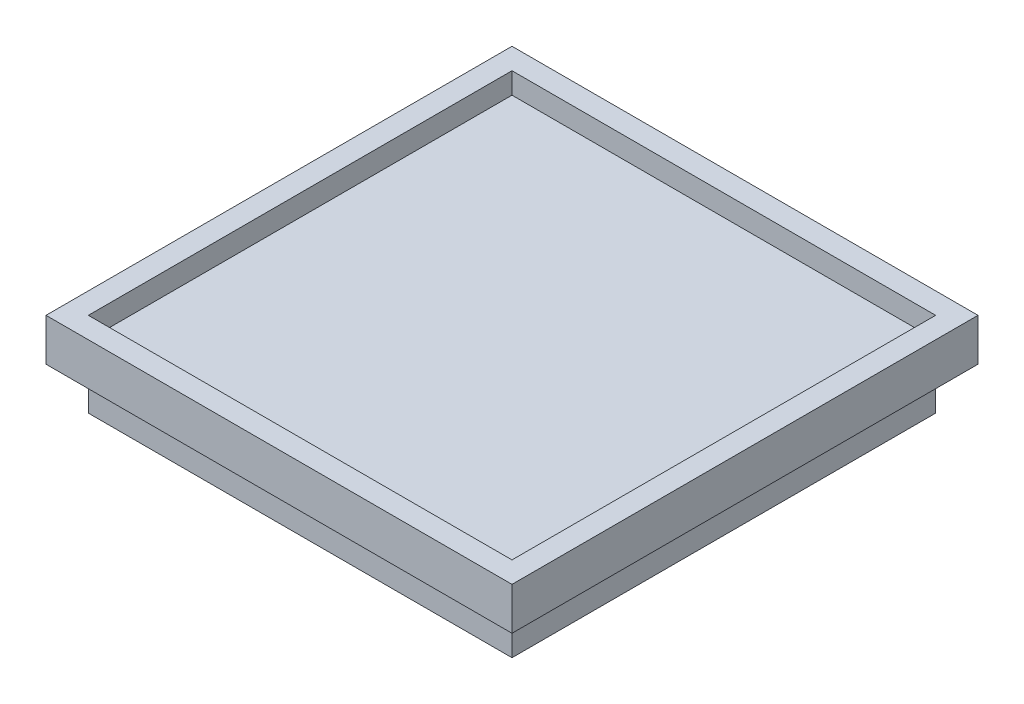
from build123d import *

# Parameters (mm, degrees)
SKETCH1_W           = 139.7
SKETCH1_H           = 139.7
BOSS_EXTRUDE1_DEPTH = 6.35
SKETCH4_W           = 139.7
SKETCH4_H           = 139.7
BOSS_EXTRUDE2_DEPTH = 6.35
SHELL1_T            = -6.35
SKETCH5_W           = 127
SKETCH5_H           = 127
BOSS_EXTRUDE4_DEPTH = 12.7
SHELL2_START        = -12.7
SHELL2_OUTLINE_W    = 114.3
SHELL2_OUTLINE_H    = 114.3
SHELL2_DEPTH        = 12.7


# Read off the part's stored shape, not the designer's step: Shell2
with BuildPart() as part:
    # Sketch1 → Boss-Extrude1 (new body)
    with BuildSketch(Plane(origin=(0, 0, 0), x_dir=(1, 0, 0), z_dir=(0, 1, 0))):
        Rectangle(SKETCH1_W, SKETCH1_H)
    extrude(amount=BOSS_EXTRUDE1_DEPTH)

    # Sketch4 → Boss-Extrude2 (add)
    with BuildSketch(Plane(origin=(0, 6.35, 0), x_dir=(1, 0, 0), z_dir=(0, 1, 0))):
        Rectangle(SKETCH4_W, SKETCH4_H)
    extrude(amount=BOSS_EXTRUDE2_DEPTH)

    # Shell1
    shell1_openings = [part.faces().sort_by_distance(p)[0] for p in [
        (0, 12.7, 0),
    ]]
    offset(amount=SHELL1_T, openings=shell1_openings, kind=Kind.INTERSECTION)

    # Sketch5 → Boss-Extrude4 (add)
    with BuildSketch(Plane(origin=(0, 0, 0), x_dir=(-1, 0, 0), z_dir=(0, -1, 0))):
        Rectangle(SKETCH5_W, SKETCH5_H)
    extrude(amount=BOSS_EXTRUDE4_DEPTH)

    # Shell2 outline → Shell2 (cut)
    with BuildSketch(Plane(origin=(0, 0, 0), x_dir=(1, 0, 0), z_dir=(0, 1, 0)).offset(SHELL2_START)):
        Rectangle(SHELL2_OUTLINE_W, SHELL2_OUTLINE_H)
    extrude(amount=SHELL2_DEPTH, mode=Mode.SUBTRACT)


solid = part.part
